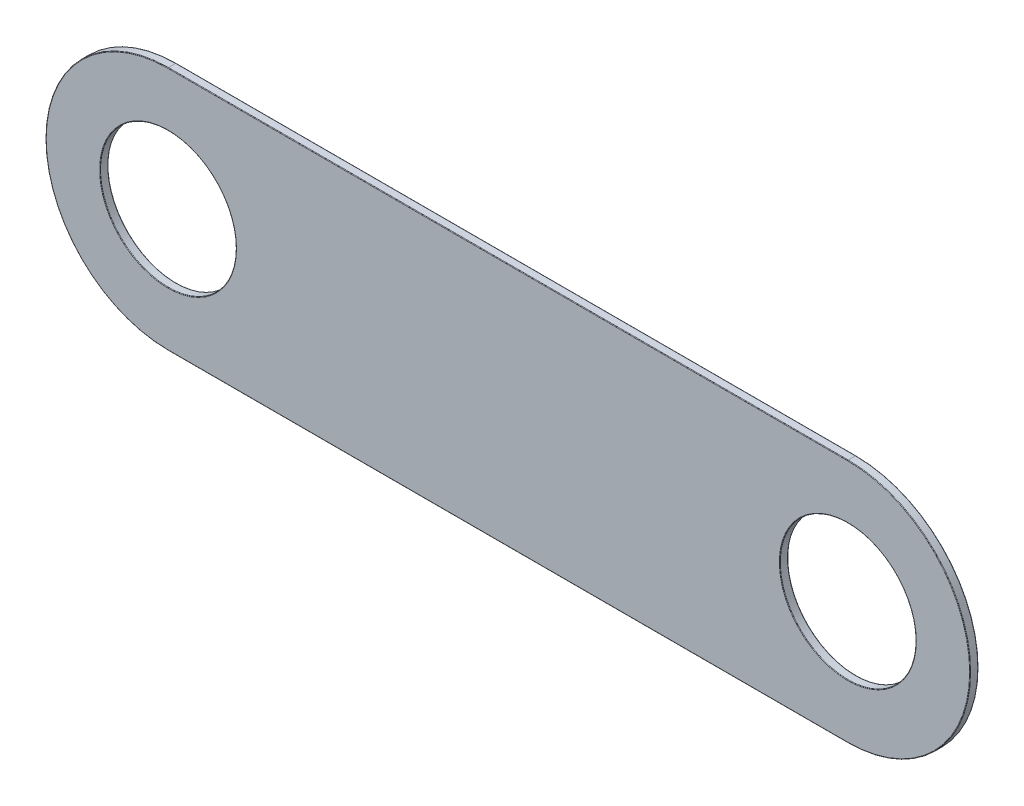
from build123d import *

# Parameters (mm, degrees)
SKETCH1_R          = 1.25
BASE_FLANGE1_DEPTH = 0.15
FILLET1_R          = 0.01


# Sheet-metal steps are written as plain solids
with BuildPart() as part:
    # Sketch1 → Base-Flange1 (new body)
    with BuildSketch(Plane.XY):
        with BuildLine():
            Line((0, -2.25), (-12.5, -2.25))
            ThreePointArc((-12.5, -2.25), (-14.75, 0), (-12.5, 2.25))
            Line((-12.5, 2.25), (0, 2.25))
            ThreePointArc((0, 2.25), (2.25, 0), (0, -2.25))
        make_face()
        with Locations((-12.5, 0)):
            Circle(SKETCH1_R, mode=Mode.SUBTRACT)
        Circle(SKETCH1_R, mode=Mode.SUBTRACT)
    extrude(amount=-BASE_FLANGE1_DEPTH)

    # Fillet1
    fillet1_edges = [part.edges().sort_by_distance(p)[0] for p in [
        (-14.75, 0, -0.15),
        (-13.75, 0, -0.15),
        (-13.75, 0, 0),
        (-6.25, -2.25, -0.15),
        (-1.25, 0, -0.15),
        (-1.25, 0, 0),
        (2.25, 0, -0.15),
        (-6.25, -2.25, 0),
        (-14.75, 0, 0),
        (-6.25, 2.25, 0),
        (2.25, 0, 0),
        (-6.25, 2.25, -0.15),
    ]]
    fillet(fillet1_edges, radius=FILLET1_R)


solid = part.part
